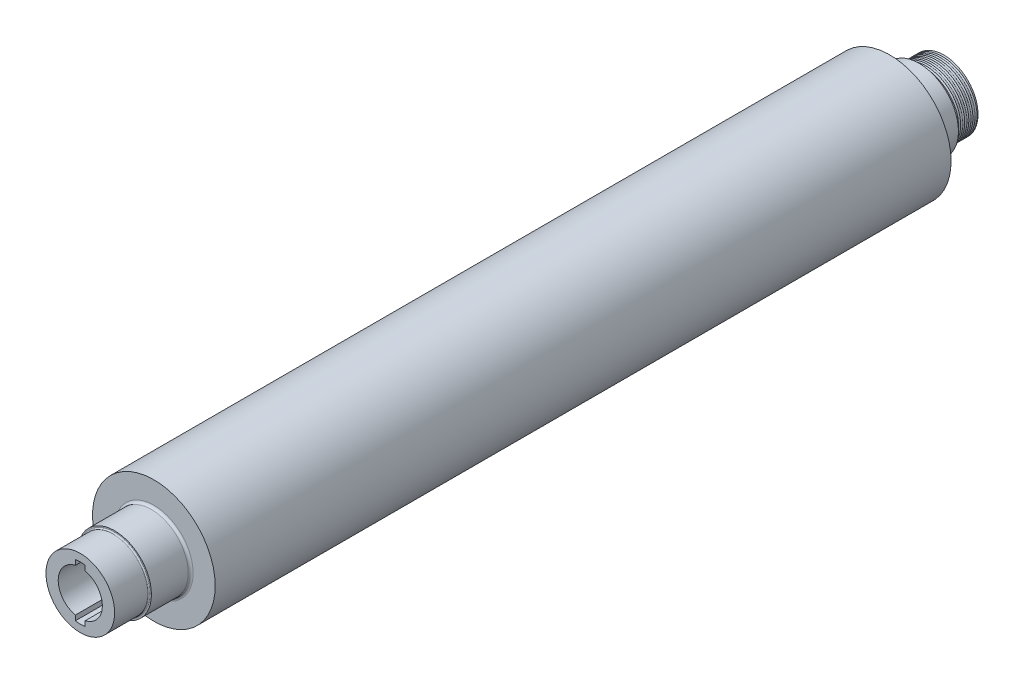
from build123d import *
from build123d.topology import SkipClean

# Parameters (mm, degrees)
SKETCH1_R           = 12.5
BOSS_EXTRUDE1_DEPTH = 150
SKETCH2_R           = 7.5
BOSS_EXTRUDE2_DEPTH = 8
FILLET1_R           = 0.5
SKETCH3_R           = 7
BOSS_EXTRUDE3_DEPTH = 7
FILLET2_R           = 0.25
SKETCH5_R           = 4.5
CUT_EXTRUDE1_DEPTH  = 166.944267753
SKETCH6_R           = 5.5
CUT_EXTRUDE2_DEPTH  = 15
BOSS_EXTRUDE4_DEPTH = 15
SKETCH8_R           = 8
SKETCH8_R_2         = 4.5
BOSS_EXTRUDE5_DEPTH = 6
FILLET3_R           = 0.5
SKETCH9_R           = 6.5
SKETCH9_R_2         = 4.5
BOSS_EXTRUDE6_DEPTH = 1
SKETCH10_R          = 7
SKETCH10_R_2        = 4.5
BOSS_EXTRUDE7_DEPTH = 4
CUT_SWEEP1_PITCH    = 0.8333333


with BuildPart() as part:
    # Sketch1 → Boss-Extrude1 (new body)
    with BuildSketch(Plane.XY):
        Circle(SKETCH1_R)
    extrude(amount=BOSS_EXTRUDE1_DEPTH)

    # Sketch2 → Boss-Extrude2 (add)
    with BuildSketch(Plane.XY.offset(150)):
        Circle(SKETCH2_R)
    extrude(amount=BOSS_EXTRUDE2_DEPTH)

    # Fillet1
    fillet1_edges = [part.edges().sort_by_distance(p)[0] for p in [
        (-7.5, 0, 150),
    ]]
    fillet(fillet1_edges, radius=FILLET1_R)

    # Sketch3 → Boss-Extrude3 (add)
    with BuildSketch(Plane.XY.offset(158)):
        Circle(SKETCH3_R)
    extrude(amount=BOSS_EXTRUDE3_DEPTH)

    # Fillet2
    fillet2_edges = [part.edges().sort_by_distance(p)[0] for p in [
        (-7, 0, 158),
    ]]
    fillet(fillet2_edges, radius=FILLET2_R)

    # Sketch5 → Cut-Extrude1 (cut, through all)
    with BuildSketch(Plane.XY.offset(165)):
        Circle(SKETCH5_R)
    extrude(amount=-CUT_EXTRUDE1_DEPTH, mode=Mode.SUBTRACT)

    # Sketch6 → Cut-Extrude2 (cut)
    with BuildSketch(Plane.XY.offset(165)):
        Circle(SKETCH6_R)
    extrude(amount=-CUT_EXTRUDE2_DEPTH, mode=Mode.SUBTRACT)

    # Sketch7 → Boss-Extrude4 (add)
    with BuildSketch(Plane.XY.offset(165)):
        with BuildLine():
            ThreePointArc((-1, -4.387482194), (-3.51781182, -2.80624304), (-4.5, 0))
            ThreePointArc((-4.5, 0), (-3.51781182, 2.80624304), (-1, 4.387482194))
            Line((-1, 4.387482194), (-1, 5.408326913))
            ThreePointArc((-1, 5.408326913), (-5.5, 0), (-1, -5.408326913))
            Line((-1, -5.408326913), (-1, -4.387482194))
        make_face()
        with BuildLine():
            ThreePointArc((1, 4.387482194), (3.51781182, 2.80624304), (4.5, 0))
            ThreePointArc((4.5, 0), (3.51781182, -2.80624304), (1, -4.387482194))
            Line((1, -4.387482194), (1, -5.408326913))
            ThreePointArc((1, -5.408326913), (4.227883631, -3.51781182), (5.5, 0))
            ThreePointArc((5.5, 0), (4.227883631, 3.51781182), (1, 5.408326913))
            Line((1, 5.408326913), (1, 4.387482194))
        make_face()
    extrude(amount=-BOSS_EXTRUDE4_DEPTH)

    # Sketch8 → Boss-Extrude5 (add)
    with SkipClean():  # the faces are left unmerged after this step: merging them gives an invalid solid
        with BuildSketch(Plane(origin=(0, 0, 0), x_dir=(-1, 0, 0), z_dir=(0, 0, -1))):
            with Locations(Location((0, 0, 0), (0, 0, 180))):
                Circle(SKETCH8_R)
            with Locations(Location((0, 0, 0), (0, 0, 102.839588407))):
                Circle(SKETCH8_R_2, mode=Mode.SUBTRACT)
        extrude(amount=BOSS_EXTRUDE5_DEPTH)
    add(part.part.scale(1), mode=Mode.REPLACE)  # the faces are merged on a copy

    # Fillet3
    fillet3_edges = [part.edges().sort_by_distance(p)[0] for p in [
        (-8, 0, 0),
    ]]
    fillet(fillet3_edges, radius=FILLET3_R)

    # Sketch9 → Boss-Extrude6 (add)
    with BuildSketch(Plane(origin=(0, 0, -6), x_dir=(-1, 0, 0), z_dir=(0, 0, -1))):
        Circle(SKETCH9_R)
        with Locations(Location((0, 0, 0), (0, 0, 102.839588407))):
            Circle(SKETCH9_R_2, mode=Mode.SUBTRACT)
    extrude(amount=BOSS_EXTRUDE6_DEPTH)

    # Sketch10 → Boss-Extrude7 (add)
    with BuildSketch(Plane(origin=(0, 0, -7), x_dir=(-1, 0, 0), z_dir=(0, 0, -1))):
        with Locations(Location((0, 0, 0), (0, 0, 180))):
            Circle(SKETCH10_R)
        with Locations(Location((0, 0, 0), (0, 0, 102.839588407))):
            Circle(SKETCH10_R_2, mode=Mode.SUBTRACT)
    extrude(amount=BOSS_EXTRUDE7_DEPTH)

    # Cut-Sweep1: arcs per turn and ends read off the stored shape
    # Cut-Sweep1: the profile of Sketch12 screwed along a right-hand helix through 6.75 turns, 8 arcs to a turn; built about Z, then put on its axis
    cut_sweep1_z = Axis((0, 0, 0), (0, 0, 1))
    cut_sweep1_corners = [(7, 0, -1.0333333), (7.2, 0, -0.8333333), (7, 0, -0.6333333), (6.8, 0, -0.8333333)]
    with BuildLine(mode=Mode.PRIVATE) as cut_sweep1_profile:
        ThreePointArc((7, 0, -1.0333333), (7.141421356, 0, -0.974754656), (7.2, 0, -0.8333333))
        ThreePointArc((7.2, 0, -0.8333333), (7.141421356, 0, -0.691911944), (7, 0, -0.6333333))
        ThreePointArc((7, 0, -0.6333333), (6.858578644, 0, -0.691911944), (6.8, 0, -0.8333333))
        ThreePointArc((6.8, 0, -0.8333333), (6.858578644, 0, -0.974754656), (7, 0, -1.0333333))
    cut_sweep1_cap = Face(cut_sweep1_profile.wire())
    cut_sweep1_arcs = [((7, 0, -1.0333333), (7.2, 0, -1.0333333), (7.2, 0, -0.8333333), (1, 0.7071067811865476, 1)), ((7.2, 0, -0.8333333), (7.2, 0, -0.6333333), (7, 0, -0.6333333), (1, 0.7071067811865476, 1)), ((7, 0, -0.6333333), (6.8, 0, -0.6333333), (6.8, 0, -0.8333333), (1, 0.7071067811865476, 1)), ((6.8, 0, -0.8333333), (6.8, 0, -1.0333333), (7, 0, -1.0333333), (1, 0.7071067811865476, 1))]  # start, shoulder, end, weights
    cut_sweep1_turn_angles = [0, 22.5, 45, 67.5, 90, 112.5, 135, 157.5, 180, 202.5, 225, 247.5, 270, 292.5, 315, 337.5, 360]
    cut_sweep1_turn_weights = [1, 0.9238795325112867, 1, 0.9238795325112867, 1, 0.9238795325112867, 1, 0.9238795325112867, 1, 0.9238795325112867, 1, 0.9238795325112867, 1, 0.9238795325112867, 1, 0.9238795325112867, 1]
    cut_sweep1_turn_sides = [Face.make_bezier_surface([[Vector(p[j][0], p[j][1], 0).rotate(cut_sweep1_z, cut_sweep1_turn_angles[2 * i + k]) / cut_sweep1_turn_weights[2 * i + k] + Vector(0, 0, p[j][2] + CUT_SWEEP1_PITCH * cut_sweep1_turn_angles[2 * i + k] / 360) for k in range(3)] for j in range(3)], [[p[3][j] * cut_sweep1_turn_weights[2 * i + k] for k in range(3)] for j in range(3)]) for p in cut_sweep1_arcs for i in range(8)]
    cut_sweep1_last_angles = [2160, 2182.5, 2205, 2227.5, 2250, 2272.5, 2295, 2317.5, 2340, 2362.5, 2385, 2407.5, 2430]
    cut_sweep1_last_weights = [1, 0.9238795325112867, 1, 0.9238795325112867, 1, 0.9238795325112867, 1, 0.9238795325112867, 1, 0.9238795325112867, 1, 0.9238795325112867, 1]
    cut_sweep1_last_sides = [Face.make_bezier_surface([[Vector(p[j][0], p[j][1], 0).rotate(cut_sweep1_z, cut_sweep1_last_angles[2 * i + k]) / cut_sweep1_last_weights[2 * i + k] + Vector(0, 0, p[j][2] + CUT_SWEEP1_PITCH * cut_sweep1_last_angles[2 * i + k] / 360) for k in range(3)] for j in range(3)], [[p[3][j] * cut_sweep1_last_weights[2 * i + k] for k in range(3)] for j in range(3)]) for p in cut_sweep1_arcs for i in range(6)]
    cut_sweep1 = Plane(origin=(0, 0, -11), x_dir=(-1, 0, 0), z_dir=(0, 0, 1)) * Solid(Shell([*[p.moved(Location((0, 0, CUT_SWEEP1_PITCH * i))) for i in range(6) for p in cut_sweep1_turn_sides], *cut_sweep1_last_sides, cut_sweep1_cap, cut_sweep1_cap.rotate(cut_sweep1_z, 2430).moved(Location((0, 0, CUT_SWEEP1_PITCH * 2430 / 360)))]))
    add(cut_sweep1, mode=Mode.SUBTRACT)


solid = part.part
